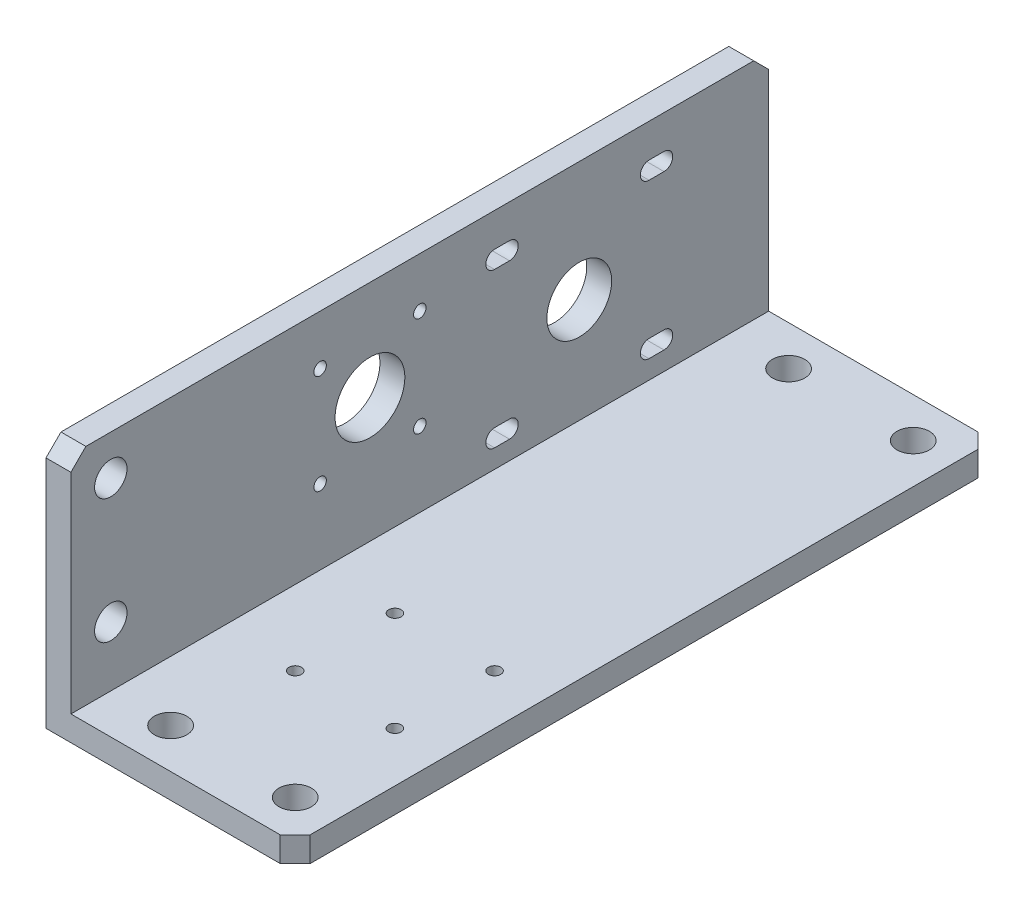
from build123d import *

# Parameters (mm, degrees)
ESTRUSIONE_ESTRUSIONE1_DEPTH = 140
FORO_6_5_6_5_1_D             = 6.5
FORO_6_5_6_5_2_D             = 6.5
FORO_6_5_6_5_2_DEPTH         = 5
FORO_6_5_6_5_2_TIP           = 1.952797012
TAGLIO_ESTRUSIONE3_REACH     = 158.844
SCHIZZO10_R                  = 7
TAGLIO_ESTRUSIONE6_REACH     = 158.844
SCHIZZO13_R                  = 6.5
SMUSSO1_SIZE                 = 3
M3_TAPPED_HOLE1_D            = 2.5
M3_TAPPED_HOLE2_D            = 2.5


with BuildPart() as part:
    # Schizzo1 → Estrusione-Estrusione1 (new body)
    with BuildSketch(Plane.XY):
        Polygon((0, 0), (0, 50), (5, 50), (5, 5), (50, 5), (50, 0), align=None)
    extrude(amount=ESTRUSIONE_ESTRUSIONE1_DEPTH)

    # Foro Ø6.5 (6.5)-1 (through all)
    with Locations(Plane(origin=(0, 0, 0), x_dir=(-1, 0, 0), z_dir=(0, -1, 0))):
        with Locations((-17, -132), (-42, -132)):
            foro_6_5_6_5_1 = Hole(FORO_6_5_6_5_1_D / 2)

    # Foro Ø6.5 (6.5)-2
    with Locations(Plane.ZY):
        with Locations((132, 42), (132, 17)):
            Hole(FORO_6_5_6_5_2_D / 2, depth=FORO_6_5_6_5_2_DEPTH)
            with Locations((0, 0, -(FORO_6_5_6_5_2_DEPTH + FORO_6_5_6_5_2_TIP / 2))):  # 118° drill point
                Cone(0, FORO_6_5_6_5_2_D / 2, FORO_6_5_6_5_2_TIP, mode=Mode.SUBTRACT)

    # Specchia1: Foro Ø6.5 (6.5)-1 across plane
    add(foro_6_5_6_5_1.mirror(Plane.XY.offset(70)), mode=Mode.SUBTRACT)

    # Schizzo10 → Taglio-Estrusione3 (cut, up to next)
    with BuildSketch(Plane.ZY, mode=Mode.PRIVATE) as taglio_estrusione3_sk1:
        with Locations((80, 30)):
            Circle(SCHIZZO10_R)
    taglio_estrusione3_tool1 = extrude(taglio_estrusione3_sk1.sketch, amount=-TAGLIO_ESTRUSIONE3_REACH, mode=Mode.PRIVATE) & part.part
    add(taglio_estrusione3_tool1.solids().sort_by_distance((0, 30, 80))[0], mode=Mode.SUBTRACT)

    # Schizzo13 → Taglio-Estrusione6 (cut, up to next)
    with BuildSketch(Plane.ZY, mode=Mode.PRIVATE) as taglio_estrusione6_sk1:
        with Locations((38, 26)):
            Circle(SCHIZZO13_R)
    taglio_estrusione6_tool1 = extrude(taglio_estrusione6_sk1.sketch, amount=-TAGLIO_ESTRUSIONE6_REACH, mode=Mode.PRIVATE) & part.part
    # Schizzo13 → Taglio-Estrusione6 (cut, up to next)
    with BuildSketch(Plane.ZY, mode=Mode.PRIVATE) as taglio_estrusione6_sk2:
        with BuildLine():
            Line((21, 43.25), (24, 43.25))
            ThreePointArc((24, 43.25), (25.75, 41.5), (24, 39.75))
            Line((24, 39.75), (21, 39.75))
            ThreePointArc((21, 39.75), (19.25, 41.5), (21, 43.25))
        make_face()
    taglio_estrusione6_tool2 = extrude(taglio_estrusione6_sk2.sketch, amount=-TAGLIO_ESTRUSIONE6_REACH, mode=Mode.PRIVATE) & part.part
    # Schizzo13 → Taglio-Estrusione6 (cut, up to next)
    with BuildSketch(Plane.ZY, mode=Mode.PRIVATE) as taglio_estrusione6_sk3:
        with BuildLine():
            Line((21, 8.75), (24, 8.75))
            ThreePointArc((24, 8.75), (25.75, 10.5), (24, 12.25))
            Line((24, 12.25), (21, 12.25))
            ThreePointArc((21, 12.25), (19.25, 10.5), (21, 8.75))
        make_face()
    taglio_estrusione6_tool3 = extrude(taglio_estrusione6_sk3.sketch, amount=-TAGLIO_ESTRUSIONE6_REACH, mode=Mode.PRIVATE) & part.part
    # Schizzo13 → Taglio-Estrusione6 (cut, up to next)
    with BuildSketch(Plane.ZY, mode=Mode.PRIVATE) as taglio_estrusione6_sk4:
        with BuildLine():
            Line((55, 43.25), (52, 43.25))
            ThreePointArc((52, 43.25), (50.25, 41.5), (52, 39.75))
            Line((52, 39.75), (55, 39.75))
            ThreePointArc((55, 39.75), (56.75, 41.5), (55, 43.25))
        make_face()
    taglio_estrusione6_tool4 = extrude(taglio_estrusione6_sk4.sketch, amount=-TAGLIO_ESTRUSIONE6_REACH, mode=Mode.PRIVATE) & part.part
    # Schizzo13 → Taglio-Estrusione6 (cut, up to next)
    with BuildSketch(Plane.ZY, mode=Mode.PRIVATE) as taglio_estrusione6_sk5:
        with BuildLine():
            Line((55, 8.75), (52, 8.75))
            ThreePointArc((52, 8.75), (50.25, 10.5), (52, 12.25))
            Line((52, 12.25), (55, 12.25))
            ThreePointArc((55, 12.25), (56.75, 10.5), (55, 8.75))
        make_face()
    taglio_estrusione6_tool5 = extrude(taglio_estrusione6_sk5.sketch, amount=-TAGLIO_ESTRUSIONE6_REACH, mode=Mode.PRIVATE) & part.part
    add(taglio_estrusione6_tool1.solids().sort_by_distance((0, 26, 38))[0], mode=Mode.SUBTRACT)
    add(taglio_estrusione6_tool2.solids().sort_by_distance((0, 41.5, 22.5))[0], mode=Mode.SUBTRACT)
    add(taglio_estrusione6_tool3.solids().sort_by_distance((0, 10.5, 22.5))[0], mode=Mode.SUBTRACT)
    add(taglio_estrusione6_tool4.solids().sort_by_distance((0, 41.5, 53.5))[0], mode=Mode.SUBTRACT)
    add(taglio_estrusione6_tool5.solids().sort_by_distance((0, 10.5, 53.5))[0], mode=Mode.SUBTRACT)

    # Smusso1
    smusso1_edges = [part.edges().sort_by_distance(p)[0] for p in [
        (50, 2.5, 0),
        (2.5, 50, 0),
        (50, 2.5, 140),
        (2.5, 50, 140),
    ]]
    chamfer(smusso1_edges, length=SMUSSO1_SIZE)

    # M3 Tapped Hole1 (through all)
    with Locations(Plane(origin=(0, 40, 70), x_dir=(0, 0, -1), z_dir=(-1, 0, 0))):
        with Locations((0, 0), (-20, 0), (-20, 20), (0, 20)):
            Hole(M3_TAPPED_HOLE1_D / 2)

    # M3 Tapped Hole2 (through all)
    with Locations(Plane(origin=(20, 0, 110), x_dir=(-1, 0, 0), z_dir=(0, -1, 0))):
        with Locations((0, 0), (-20, 0), (-20, 20), (0, 20)):
            Hole(M3_TAPPED_HOLE2_D / 2)


solid = part.part
